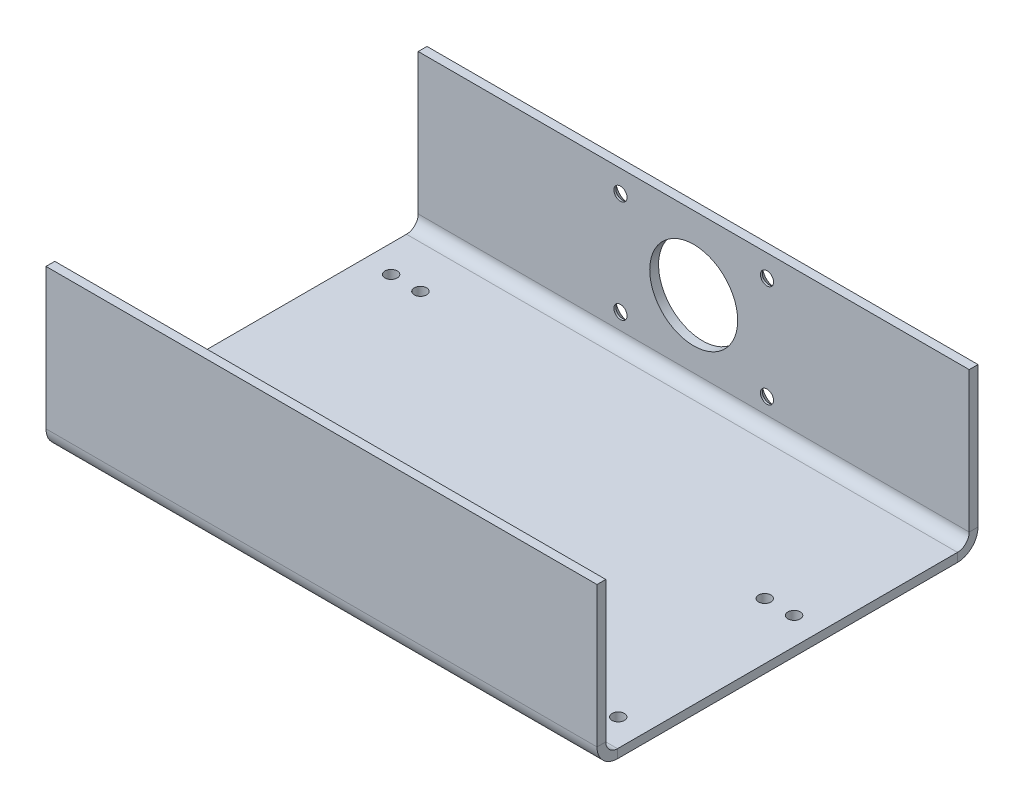
from build123d import *

# Parameters (mm, degrees)
SKETCH1_W                                            = 188
SKETCH1_H                                            = 130
BOSS_EXTRUDE1_DEPTH                                  = 3
EDGE_FLANGE1_STRIP_W                                 = 20
EDGE_FLANGE1_STRIP_H                                 = 3
EDGE_FLANGE1_STRIP_CUT_DEPTH                         = 188
EDGE_FLANGE1_STRIP_2_W                               = 20
EDGE_FLANGE1_STRIP_2_H                               = 3
EDGE_FLANGE1_STRIP_CUT_2_DEPTH                       = 188
EDGE_FLANGE1_DEPTH                                   = 188
EDGE_FLANGE1_BEND_DEPTH                              = 188
SKETCH8_R                                            = 15
CUT_EXTRUDE1_DEPTH                                   = 10
CSK_FOR_M4_HEX_SOCKET_COUNTERSUNK_HEAD_S_D           = 4.5
CSK_FOR_M4_HEX_SOCKET_COUNTERSUNK_HEAD_S_DEPTH       = 10
CSK_FOR_M4_HEX_SOCKET_COUNTERSUNK_HEAD_S_CSINK_D     = 9.18
CSK_FOR_M4_HEX_SOCKET_COUNTERSUNK_HEAD_S_CSINK_ANGLE = 90
CSK_FOR_M4_HEX_SOCKET_COUNTERSUNK_HEAD_S_TIP         = 1.351936393
SKETCH12_R                                           = 2.1
CUT_EXTRUDE2_DEPTH                                   = 10


# Sheet-metal steps are written as plain solids
with BuildPart() as part:
    # Sketch1 → Boss-Extrude1 (new body)
    with BuildSketch(Plane(origin=(0, 0, 0), x_dir=(1, 0, 0), z_dir=(0, 1, 0))):
        Rectangle(SKETCH1_W, SKETCH1_H)
    extrude(amount=BOSS_EXTRUDE1_DEPTH)

    # Edge-Flange1 strip (across the edge) → Edge-Flange1 strip cut (cut)
    with BuildSketch(Plane(origin=(94, 3, -65), x_dir=(0, 0, 1), z_dir=(-1, 0, 0))):
        with Locations((-3, -1.5)):
            Rectangle(EDGE_FLANGE1_STRIP_W, EDGE_FLANGE1_STRIP_H)
    extrude(amount=EDGE_FLANGE1_STRIP_CUT_DEPTH, mode=Mode.SUBTRACT)

    # Edge-Flange1 strip 2 (across the edge) → Edge-Flange1 strip cut 2 (cut)
    with BuildSketch(Plane(origin=(-94, 3, 65), x_dir=(0, 0, -1), z_dir=(1, 0, 0))):
        with Locations((-3, -1.5)):
            Rectangle(EDGE_FLANGE1_STRIP_2_W, EDGE_FLANGE1_STRIP_2_H)
    extrude(amount=EDGE_FLANGE1_STRIP_CUT_2_DEPTH, mode=Mode.SUBTRACT)

    # Edge-Flange1 section (across the edge) → Edge-Flange1 (add)
    with BuildSketch(Plane(origin=(94, 3, -65), x_dir=(0, 0, 1), z_dir=(-1, 0, 0))):
        with BuildLine():
            Line((0, 4), (0, 52))
            Line((0, 52), (3, 52))
            Line((3, 52), (3, 4))
            ThreePointArc((3, 4), (4.171572875, 1.171572875), (7, 0))
            Line((7, 0), (7, -3))
            ThreePointArc((7, -3), (2.050252532, -0.949747468), (0, 4))
        make_face()
    extrude(amount=EDGE_FLANGE1_DEPTH)

    # Edge-Flange1 section 2 (across the edge) → Edge-Flange1 bend (add)
    with BuildSketch(Plane(origin=(-94, 3, 65), x_dir=(0, 0, -1), z_dir=(1, 0, 0))):
        with BuildLine():
            Line((0, 4), (0, 52))
            Line((0, 52), (3, 52))
            Line((3, 52), (3, 4))
            ThreePointArc((3, 4), (4.171572875, 1.171572875), (7, 0))
            Line((7, 0), (7, -3))
            ThreePointArc((7, -3), (2.050252532, -0.949747468), (0, 4))
        make_face()
    extrude(amount=EDGE_FLANGE1_BEND_DEPTH)

    # Sketch8 → Cut-Extrude1 (cut)
    with BuildSketch(Plane(origin=(0, 0, -65), x_dir=(-1, 0, 0), z_dir=(0, 0, -1))):
        with Locations(Location((0, 30, 0), (0, 0, 90))):
            Circle(SKETCH8_R)
    extrude(amount=-CUT_EXTRUDE1_DEPTH, mode=Mode.SUBTRACT)

    # CSK for M4 Hex Socket Countersunk Head Screw1
    with Locations(Plane(origin=(0, 0, -65), x_dir=(-1, 0, 0), z_dir=(0, 0, -1))):
        with Locations((-25, 47.478966411), (-25, 12.521033589), (25, 47.478966411), (25, 12.521033589)):
            CounterSinkHole(CSK_FOR_M4_HEX_SOCKET_COUNTERSUNK_HEAD_S_D / 2, CSK_FOR_M4_HEX_SOCKET_COUNTERSUNK_HEAD_S_CSINK_D / 2, depth=CSK_FOR_M4_HEX_SOCKET_COUNTERSUNK_HEAD_S_DEPTH, counter_sink_angle=CSK_FOR_M4_HEX_SOCKET_COUNTERSUNK_HEAD_S_CSINK_ANGLE)
            with Locations((0, 0, -(CSK_FOR_M4_HEX_SOCKET_COUNTERSUNK_HEAD_S_DEPTH + CSK_FOR_M4_HEX_SOCKET_COUNTERSUNK_HEAD_S_TIP / 2))):  # 118° drill point
                Cone(0, CSK_FOR_M4_HEX_SOCKET_COUNTERSUNK_HEAD_S_D / 2, CSK_FOR_M4_HEX_SOCKET_COUNTERSUNK_HEAD_S_TIP, mode=Mode.SUBTRACT)

    # Sketch12 → Cut-Extrude2 (cut)
    with BuildSketch(Plane(origin=(0, 0, 0), x_dir=(-1, 0, 0), z_dir=(0, -1, 0))):
        with Locations(Location((74.75, 43.5, 0), (0, 0, 90))):
            Circle(SKETCH12_R)
        with Locations(Location((84.75, 43.5, 0), (0, 0, 90))):
            Circle(SKETCH12_R)
        with Locations(Location((74.75, -16.5, 0), (0, 0, 90))):
            Circle(SKETCH12_R)
        with Locations(Location((84.75, -16.5, 0), (0, 0, 90))):
            Circle(SKETCH12_R)
        with Locations(Location((-74.75, 11.5, 0), (0, 0, 90))):
            Circle(SKETCH12_R)
        with Locations(Location((-84.75, 11.5, 0), (0, 0, 90))):
            Circle(SKETCH12_R)
        with Locations(Location((-74.75, -48.5, 0), (0, 0, 90))):
            Circle(SKETCH12_R)
        with Locations(Location((-84.75, -48.5, 0), (0, 0, 90))):
            Circle(SKETCH12_R)
    extrude(amount=-CUT_EXTRUDE2_DEPTH, mode=Mode.SUBTRACT)


solid = part.part
